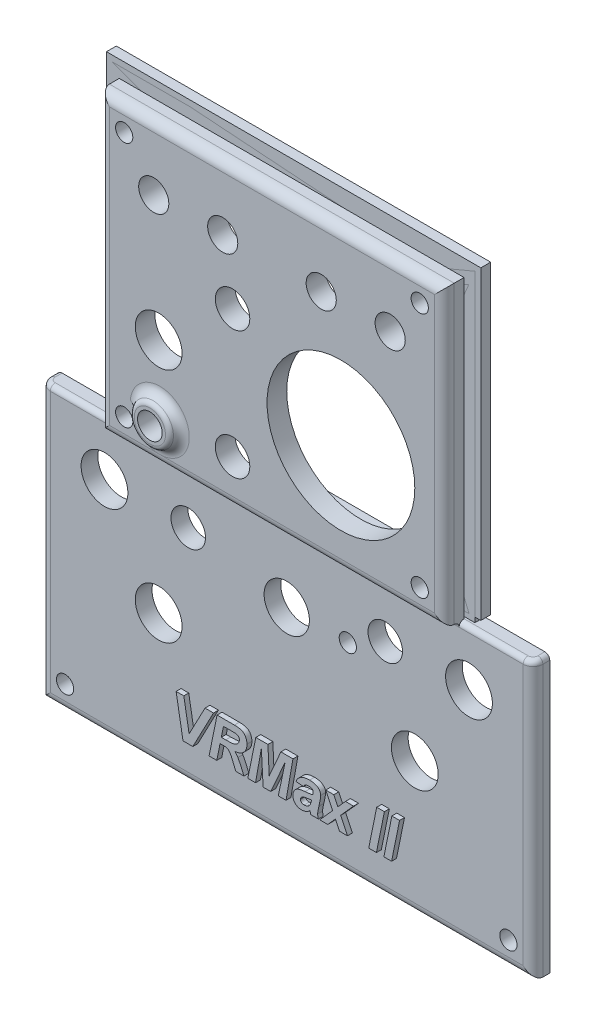
from build123d import *

# Parameters (mm, degrees)
SKETCH1_W                 = 70
SKETCH1_H                 = 60
BOSS_EXTRUDE1_DEPTH       = 4
SKETCH2_W                 = 63.6
SKETCH2_H                 = 53.6
SKETCH2_W_2               = 57.6
SKETCH2_H_2               = 47.6
BOSS_EXTRUDE2_DEPTH       = 2.4
CHAMFER1_SIZE             = 0.5
CHAMFER1_SIZE2            = 1.37373871
FILLET1_R                 = 2
SKETCH3_R                 = 3.060318858
CUT_EXTRUDE1_DEPTH        = 47.539875376
SKETCH4_R                 = 15
CUT_EXTRUDE2_DEPTH        = 47.539875376
SKETCH5_R                 = 3.5
CUT_EXTRUDE3_DEPTH        = 47.539875376
SKETCH6_R                 = 5
SKETCH6_R_2               = 3.060318858
BOSS_EXTRUDE3_DEPTH       = 2
FILLET2_R                 = 1
CUT_EXTRUDE4_REACH        = 48.54
SKETCH7_W                 = 20
SKETCH7_H                 = 60
SKETCH8_R                 = 4.75
CUT_EXTRUDE5_DEPTH        = 47.270941205
CUT_EXTRUDE6_DEPTH        = 47.270941205
CUT_EXTRUDE6_DEPTH_BACK   = 47.270941205
SKETCH9_R                 = 1.75
SKETCH10_R                = 2
CUT_EXTRUDE7_DEPTH        = 2
SKETCH11_R                = 4.75
SKETCH11_R_2              = 3.060318858
BOSS_EXTRUDE4_DEPTH       = 2.4
SKETCH12_R                = 5
CUT_EXTRUDE9_DEPTH        = 47.270941205
SKETCH13_R                = 2.5
CUT_EXTRUDE10_DEPTH       = 47.270941205
SKETCH14_W                = 9
SKETCH14_H                = 9
SKETCH14_W_2              = 6.5
SKETCH14_H_2              = 6.5
BOSS_EXTRUDE5_DEPTH       = 2.4
SKETCH17_R                = 4
SKETCH17_R_2              = 2.5
BOSS_EXTRUDE7_DEPTH       = 2
FILLET5_R                 = 2
FILLET6_R                 = 1
SKETCH18_R                = 3.75
CUT_EXTRUDE13_DEPTH       = 47.539875376
BOSS_EXTRUDE8_START       = 0.4
SKETCH19_W                = 73.6
SKETCH19_H                = 63.6
SKETCH19_W_2              = 65.6
SKETCH19_H_2              = 55.6
BOSS_EXTRUDE8_DEPTH       = 2
SKETCH21_R                = 9.090654542
CUT_EXTRUDE15_DEPTH       = 50.004897727
SKETCH20_W                = 4.957633968
SKETCH20_H                = 6.255912851
SUPPORT_DEPTH             = 2
BOSS_EXTRUDE11_DEPTH      = 2.4
BOSS_EXTRUDE11_DEPTH_BACK = 1
FILLET7_R                 = 2
FILLET8_R                 = 1
FILLET9_R                 = 1
SKETCH24_R                = 4.6
SKETCH24_R_2              = 4.75
SKETCH24_R_3              = 3.5
CUT_EXTRUDE16_DEPTH       = 100.604216783
SKETCH25_R                = 1.75
CUT_EXTRUDE17_DEPTH       = 100.832659995
SKETCH26_R                = 1.75
CUT_EXTRUDE18_DEPTH       = 100.832659995
SKETCH27_R                = 1.75
CUT_EXTRUDE19_DEPTH       = 2
BOSS_EXTRUDE12_DEPTH      = 1
SUPPORT_STRUCT_START      = 0.4
SUPPORT_STRUCT_DEPTH      = 2


# Some blends are built 0.0001 mm under size
with BuildPart() as part:
    # Sketch1 → Boss-Extrude1 (new body)
    with BuildSketch(Plane.XY):
        Rectangle(SKETCH1_W, SKETCH1_H)
    extrude(amount=BOSS_EXTRUDE1_DEPTH)

    # Sketch2 → Boss-Extrude2 (add)
    with BuildSketch(Plane(origin=(0, 0, 0), x_dir=(-1, 0, 0), z_dir=(0, 0, -1))):
        Rectangle(SKETCH2_W, SKETCH2_H)
        Rectangle(SKETCH2_W_2, SKETCH2_H_2, mode=Mode.SUBTRACT)
    extrude(amount=BOSS_EXTRUDE2_DEPTH)

    # Chamfer1
    chamfer1_edges = [part.edges().sort_by_distance(p)[0] for p in [
        (-31.8, 0, -2.4),
        (0, 26.8, -2.4),
        (31.8, 0, -2.4),
        (0, -26.8, -2.4),
    ]]
    chamfer1_side = [part.faces().sort_by_distance(p)[0] for p in [
        (0, 25.968259656, -2.4),
    ]]
    chamfer(chamfer1_edges, length=CHAMFER1_SIZE, length2=CHAMFER1_SIZE2, reference=chamfer1_side[0])

    # Fillet1
    fillet1_edges = [part.edges().sort_by_distance(p)[0] for p in [
        (35, 0, 4),
        (0, 30, 4),
        (-35, 0, 4),
        (0, -30, 4),
    ]]
    fillet(fillet1_edges, radius=FILLET1_R)

    # Sketch3 → Cut-Extrude1 (cut, through all)
    with BuildSketch(Plane.XY.offset(4)):
        with Locations((-24, 17)):
            Circle(SKETCH3_R)
        with Locations((10, 17)):
            Circle(SKETCH3_R)
        with Locations((-10, 17)):
            Circle(SKETCH3_R)
        with Locations((24, 17)):
            Circle(SKETCH3_R)
    extrude(amount=-CUT_EXTRUDE1_DEPTH, mode=Mode.SUBTRACT)

    # Sketch4 → Cut-Extrude2 (cut, through all)
    with BuildSketch(Plane.XY.offset(4)):
        with Locations((14, -8)):
            Circle(SKETCH4_R)
    extrude(amount=-CUT_EXTRUDE2_DEPTH, mode=Mode.SUBTRACT)

    # Sketch5 → Cut-Extrude3 (cut, through all)
    with BuildSketch(Plane.XY.offset(4)):
        with Locations((-8, 5)):
            Circle(SKETCH5_R)
        with Locations((-8, -21)):
            Circle(SKETCH5_R)
    extrude(amount=-CUT_EXTRUDE3_DEPTH, mode=Mode.SUBTRACT)

    # Sketch6 → Boss-Extrude3 (add)
    # profile 1 of 2: a face of its own
    with BuildSketch(Plane(origin=(0, 0, 0), x_dir=(-1, 0, 0), z_dir=(0, 0, -1))):
        with Locations((24, 17)):
            Circle(SKETCH6_R)
        with Locations(Location((24, 17, 0), (0, 0, 180))):
            Circle(SKETCH6_R_2, mode=Mode.SUBTRACT)
    # profile 2 of 2: a face of its own
    with BuildSketch(Plane(origin=(0, 0, 0), x_dir=(-1, 0, 0), z_dir=(0, 0, -1))):
        with Locations((-24, 17)):
            Circle(SKETCH6_R)
        with Locations(Location((-24, 17, 0), (0, 0, 180))):
            Circle(SKETCH6_R_2, mode=Mode.SUBTRACT)
    extrude(amount=BOSS_EXTRUDE3_DEPTH)

    # Fillet2
    fillet2_edges = [part.edges().sort_by_distance(p)[0] for p in [
        (28.8, 18.4, -1),
        (28.8, 15.6, -1),
        (28.8, 23.8, -1.2),
    ]]
    fillet(fillet2_edges, radius=FILLET2_R)

    # Cut-Extrude4: up to this face of the body (flat: up to its plane)
    cut_extrude4_end = Plane(part.part.faces().sort_by_distance((-5.37613494, 1.437428998, 0))[0])
    # Sketch7 → Cut-Extrude4 (cut, up to the picked face)
    with BuildSketch(Plane(origin=(0, 0, -2.4), x_dir=(-1, 0, 0), z_dir=(0, 0, -1)), mode=Mode.PRIVATE) as cut_extrude4_sk1:
        with Locations((25, -2.259161332)):
            Rectangle(SKETCH7_W, SKETCH7_H)
    cut_extrude4_tool1 = split(extrude(cut_extrude4_sk1.sketch, amount=-CUT_EXTRUDE4_REACH, mode=Mode.PRIVATE), bisect_by=cut_extrude4_end, keep=Keep.BOTH, mode=Mode.PRIVATE)
    add(cut_extrude4_tool1.solids().sort_by(Axis((-25, -2.259161, -2.4), (0, 0, 1)))[0], mode=Mode.SUBTRACT)

    # Sketch8 → Cut-Extrude5 (cut, through all)
    with BuildSketch(Plane(origin=(0, 0, 0), x_dir=(-1, 0, 0), z_dir=(0, 0, -1))):
        with Locations((23, -8)):
            Circle(SKETCH8_R)
    extrude(amount=-CUT_EXTRUDE5_DEPTH, mode=Mode.SUBTRACT)

    # Sketch9 → Cut-Extrude6 (cut, two sides: drawn at the far end of the back side and taken through both)
    with BuildSketch(Plane(origin=(0, 0, 0), x_dir=(-1, 0, 0), z_dir=(0, 0, -1)).offset(-CUT_EXTRUDE6_DEPTH_BACK)):
        with Locations((30, 25)):
            Circle(SKETCH9_R)
        with Locations((30, -25)):
            Circle(SKETCH9_R)
        with Locations((-30, -25)):
            Circle(SKETCH9_R)
        with Locations((-30, 25)):
            Circle(SKETCH9_R)
    extrude(amount=CUT_EXTRUDE6_DEPTH + CUT_EXTRUDE6_DEPTH_BACK, mode=Mode.SUBTRACT)

    # Sketch10 → Cut-Extrude7 (cut)
    with BuildSketch(Plane(origin=(0, 0, 0), x_dir=(-1, 0, 0), z_dir=(0, 0, -1))):
        with Locations((23, 1)):
            Circle(SKETCH10_R)
    extrude(amount=-CUT_EXTRUDE7_DEPTH, mode=Mode.SUBTRACT)

    # Sketch11 → Boss-Extrude4 (add)
    with BuildSketch(Plane(origin=(0, 0, 0), x_dir=(-1, 0, 0), z_dir=(0, 0, -1))):
        with Locations(Location((24, 17, 0), (0, 0, 180))):
            Circle(SKETCH11_R)
        with Locations(Location((24, 17, 0), (0, 0, 180))):
            Circle(SKETCH11_R_2, mode=Mode.SUBTRACT)
    extrude(amount=BOSS_EXTRUDE4_DEPTH)

    # Sketch12 → Cut-Extrude9 (cut, through all)
    with BuildSketch(Plane(origin=(0, 0, 0), x_dir=(-1, 0, 0), z_dir=(0, 0, -1))):
        with Locations((-30, 25)):
            Circle(SKETCH12_R)
        with Locations((-30, -25)):
            Circle(SKETCH12_R)
    extrude(amount=CUT_EXTRUDE9_DEPTH, mode=Mode.SUBTRACT)

    # Sketch13 → Cut-Extrude10 (cut, through all)
    with BuildSketch(Plane(origin=(0, 0, 0), x_dir=(-1, 0, 0), z_dir=(0, 0, -1))):
        with Locations((22.783208656, -22)):
            Circle(SKETCH13_R)
    extrude(amount=-CUT_EXTRUDE10_DEPTH, mode=Mode.SUBTRACT)

    # Sketch14 → Boss-Extrude5 (add)
    with BuildSketch(Plane(origin=(0, 0, 0), x_dir=(-1, 0, 0), z_dir=(0, 0, -1))):
        with Locations((22.783208656, -22)):
            Rectangle(SKETCH14_W, SKETCH14_H)
        with Locations((22.783208656, -22)):
            Rectangle(SKETCH14_W_2, SKETCH14_H_2, mode=Mode.SUBTRACT)
    extrude(amount=BOSS_EXTRUDE5_DEPTH)

    # Sketch17 → Boss-Extrude7 (add)
    with BuildSketch(Plane.XY.offset(4)):
        with Locations((-22.783208656, -22)):
            Circle(SKETCH17_R)
        with Locations(Location((-22.783208656, -22, 0), (0, 0, 180))):
            Circle(SKETCH17_R_2, mode=Mode.SUBTRACT)
    extrude(amount=BOSS_EXTRUDE7_DEPTH)

    # Fillet5
    fillet5_edges = [part.edges().sort_by_distance(p)[0] for p in [
        (-26.783208656, -22, 4),
    ]]
    fillet(fillet5_edges, radius=FILLET5_R - 0.0001)  # a hair under: the kernel refuses the full size

    # Fillet6
    fillet6_edges = [part.edges().sort_by_distance(p)[0] for p in [
        (-26.783208656, -22, 6),
    ]]
    fillet(fillet6_edges, radius=FILLET6_R)

    # Sketch18 → Cut-Extrude13 (cut, through all)
    with BuildSketch(Plane.XY.offset(4)):
        with Locations((-30, -25)):
            Circle(SKETCH18_R)
    extrude(amount=CUT_EXTRUDE13_DEPTH, mode=Mode.SUBTRACT)

    # Sketch21 → Cut-Extrude15 (cut, through all)
    with BuildSketch(Plane(origin=(0, 0, 0), x_dir=(-1, 0, 0), z_dir=(0, 0, -1))):
        with Locations((8, -21)):
            Circle(SKETCH21_R)
    extrude(amount=CUT_EXTRUDE15_DEPTH, mode=Mode.SUBTRACT)

    # Sketch23 → Boss-Extrude11 (add, two sides: drawn at the far end of the back side and taken through both)
    with BuildSketch(Plane(origin=(0, 0, 0), x_dir=(-1, 0, 0), z_dir=(0, 0, -1)).offset(-BOSS_EXTRUDE11_DEPTH_BACK)):
        Polygon((35, -30), (50, -30), (50, -86), (-50, -86), (-50, -30), (-35, -30), align=None)
    extrude(amount=BOSS_EXTRUDE11_DEPTH + BOSS_EXTRUDE11_DEPTH_BACK)

    # Fillet7
    fillet7_edges = [part.edges().sort_by_distance(p)[0] for p in [
        (-50, -58, 1),
        (0, -86, 1),
        (50, -58, 1),
    ]]
    fillet(fillet7_edges, radius=FILLET7_R)

    # Fillet8
    # the kernel refuses this fillet: 1 mm, written as the material it takes off along each edge
    with BuildSketch(Plane(origin=(50, -30, -1), x_dir=(0, -1, 0), z_dir=(0, 0, -1)), Plane(origin=(-50, -30, -4.9), x_dir=(0, -1, 0), z_dir=(0, 0, 1))) as fillet8_piece_1:
        with BuildLine():
            CenterArc((FILLET8_R, FILLET8_R), FILLET8_R, 180, 90)
            Line((0, FILLET8_R), (0, 0))
            Line((0, 0), (FILLET8_R, 0))
        make_face()
    extrude(amount=3.9, mode=Mode.SUBTRACT)
    with BuildSketch(Plane(origin=(48, -30, -1), x_dir=(0, 0, 1), z_dir=(-1, 0, 0))) as fillet8_piece_2:
        with BuildLine():
            CenterArc((2 - FILLET8_R, -FILLET8_R), FILLET8_R, 0, 90)
            Line((2 - FILLET8_R, 0), (2, 0))
            Line((2, 0), (2, -FILLET8_R))
        make_face()
    revolve(axis=Axis((48, -30, -1), (0, 1, 0)), revolution_arc=90, mode=Mode.SUBTRACT)
    with BuildSketch(Plane(origin=(35, -30, 1), x_dir=(0, -1, 0), z_dir=(1, 0, 0)), Plane(origin=(-48, -30, 1), x_dir=(0, -1, 0), z_dir=(1, 0, 0))) as fillet8_piece_3:
        with BuildLine():
            CenterArc((FILLET8_R, FILLET8_R), FILLET8_R, 180, 90)
            Line((0, FILLET8_R), (0, 0))
            Line((0, 0), (FILLET8_R, 0))
        make_face()
    extrude(amount=13, mode=Mode.SUBTRACT)
    with BuildSketch(Plane(origin=(-48, -30, -1), x_dir=(0, 0, 1), z_dir=(1, 0, 0))) as fillet8_piece_4:
        with BuildLine():
            CenterArc((2 - FILLET8_R, FILLET8_R), FILLET8_R, 270, 90)
            Line((2 - FILLET8_R, 0), (2, 0))
            Line((2, 0), (2, FILLET8_R))
        make_face()
    revolve(axis=Axis((-48, -30, -1), (0, -1, 0)), revolution_arc=90, mode=Mode.SUBTRACT)

    # Fillet9
    fillet9_edges = [part.edges().sort_by_distance(p)[0] for p in [
        (0, -30, 1),
    ]]
    fillet(fillet9_edges, radius=FILLET9_R - 0.0001)  # a hair under: the kernel refuses the full size

    # Sketch24 → Cut-Extrude16 (cut, through all)
    with BuildSketch(Plane.XY.offset(1)):
        with Locations((0, -45)):
            Circle(SKETCH24_R)
        with Locations((-37, -41)):
            Circle(SKETCH24_R_2)
        with Locations((37, -41)):
            Circle(SKETCH24_R_2)
        with Locations((-26, -59)):
            Circle(SKETCH24_R_2)
        with Locations((26, -59)):
            Circle(SKETCH24_R_2)
        with Locations((-20, -41)):
            Circle(SKETCH24_R_3)
        with Locations((20, -41)):
            Circle(SKETCH24_R_3)
    extrude(amount=-CUT_EXTRUDE16_DEPTH, mode=Mode.SUBTRACT)

    # Sketch25 → Cut-Extrude17 (cut, through all)
    with BuildSketch(Plane(origin=(0, 0, -2.4), x_dir=(-1, 0, 0), z_dir=(0, 0, -1))):
        with Locations((45, -81)):
            Circle(SKETCH25_R)
        with Locations((-45, -81)):
            Circle(SKETCH25_R)
    extrude(amount=-CUT_EXTRUDE17_DEPTH, mode=Mode.SUBTRACT)

    # Sketch26 → Cut-Extrude18 (cut, through all)
    with BuildSketch(Plane(origin=(0, 0, -2.4), x_dir=(-1, 0, 0), z_dir=(0, 0, -1))):
        with Locations((-12.4, -45)):
            Circle(SKETCH26_R)
    extrude(amount=-CUT_EXTRUDE18_DEPTH, mode=Mode.SUBTRACT)

    # Sketch27 → Cut-Extrude19 (cut)
    with BuildSketch(Plane(origin=(0, 0, -2.4), x_dir=(-1, 0, 0), z_dir=(0, 0, -1))):
        with Locations((17.3, -59)):
            Circle(SKETCH27_R)
        with Locations((-17.3, -59)):
            Circle(SKETCH27_R)
        with Locations((-28.3, -41)):
            Circle(SKETCH27_R)
        with Locations((28.3, -41)):
            Circle(SKETCH27_R)
    extrude(amount=-CUT_EXTRUDE19_DEPTH, mode=Mode.SUBTRACT)

    # Sketch28 → Boss-Extrude12 (add)
    # profile 1 of 7: a face of its own
    with BuildSketch(Plane.XY.offset(1)):
        Polygon((-18.065705128, -78), (-20.057692308, -78), (-21.456730769, -70), (-19.897435897, -70), (-18.820512821, -76.153846154), (-15.58974359, -70), (-13.866987179, -70), align=None)
    # profile 2 of 7: a face of its own
    with BuildSketch(Plane.XY.offset(1)):
        with BuildLine():
            Line((-13.201923077, -78), (-14.769230769, -78))
            Line((-14.769230769, -78), (-13.142628205, -70))
            Line((-13.142628205, -70), (-9.620192308, -70))
            add(Edge.make_bspline(
                [(-9.620192308, -70), (-9.546475051, -70.000807233), (-9.403269954, -70.002375386), (-9.194671422, -70.008965823), (-8.999329388, -70.026786672), (-8.815573362, -70.043984889), (-8.645219924, -70.071996557), (-8.486735057, -70.103596159), (-8.340952315, -70.1415341), (-8.206825844, -70.187125768), (-8.080888635, -70.237848334), (-7.964227917, -70.301932313), (-7.850893828, -70.37161524), (-7.745347224, -70.453544028), (-7.647122188, -70.546194049), (-7.553486884, -70.647591974), (-7.46610026, -70.759015456), (-7.385748319, -70.879580955), (-7.313716751, -71.008268298), (-7.249474489, -71.143368983), (-7.196864869, -71.286402734), (-7.151276952, -71.434794296), (-7.118305758, -71.590977865), (-7.094191928, -71.753657589), (-7.079641835, -71.922811057), (-7.077836759, -72.037899241), (-7.076923077, -72.096153846)],
                knots=[0, 0, 0, 0, 1.397997146, 2.71578631, 3.955711479, 5.116837282, 6.214271876, 7.22740948, 8.180699214, 9.067986365, 9.91261871, 10.750971626, 11.588467393, 12.433342657, 13.279006929, 14.146412957, 15.048152737, 15.961200041, 16.890950814, 17.84251689, 18.794514173, 19.778313476, 20.783622796, 21.817908339, 22.895482704, 24, 24, 24, 24], degree=3))
            add(Edge.make_bspline(
                [(-7.076923077, -72.096153846), (-7.078809064, -72.179563216), (-7.082494755, -72.342566023), (-7.110224834, -72.581717618), (-7.155985187, -72.809315221), (-7.222291198, -73.026070649), (-7.307511401, -73.231366647), (-7.410122148, -73.426744003), (-7.532868629, -73.60975828), (-7.67267657, -73.782075802), (-7.830964936, -73.942168487), (-8.012646875, -74.082294502), (-8.210686783, -74.210545035), (-8.430103901, -74.321011767), (-8.669860126, -74.414600492), (-8.928180352, -74.495359601), (-9.206643236, -74.557225265), (-9.399371554, -74.586116772), (-9.498397436, -74.600961538)],
                knots=[0, 0, 0, 0, 1.034210287, 2.021106028, 2.981224027, 3.909550721, 4.827322501, 5.734126229, 6.641776499, 7.55535462, 8.482853643, 9.42644268, 10.394866648, 11.405142831, 12.466783848, 13.583603239, 14.758429358, 16, 16, 16, 16], degree=3))
            add(Edge.make_bspline(
                [(-9.498397436, -74.600961538), (-9.445459712, -74.650650633), (-9.336358501, -74.753056629), (-9.18970531, -74.932326156), (-9.041486416, -75.128669962), (-8.953867379, -75.273183794), (-8.908653846, -75.34775641)],
                knots=[0, 0, 0, 0, 0.911289116, 1.878107672, 2.905052469, 4, 4, 4, 4], degree=3))
            add(Edge.make_bspline(
                [(-8.908653846, -75.34775641), (-8.862269714, -75.429779293), (-8.76565771, -75.600622098), (-8.623961685, -75.872042647), (-8.475404655, -76.166475379), (-8.328293277, -76.487420171), (-8.173380034, -76.830985687), (-8.015668279, -77.198734057), (-7.852907952, -77.590508542), (-7.746854124, -77.860919916), (-7.692307692, -78)],
                knots=[0, 0, 0, 0, 0.774320282, 1.612806617, 2.515893427, 3.484157077, 4.513797032, 5.613040525, 6.772320409, 8, 8, 8, 8], degree=3))
            Line((-7.692307692, -78), (-9.333333333, -78))
            add(Edge.make_bspline(
                [(-9.333333333, -78), (-9.353769455, -77.940026866), (-9.397439662, -77.811869521), (-9.47613188, -77.609683987), (-9.565065419, -77.382866314), (-9.667618444, -77.132596804), (-9.785455556, -76.860197696), (-9.915257887, -76.563718193), (-10.057625339, -76.242836599), (-10.158945085, -76.021791878), (-10.211538462, -75.907051282)],
                knots=[0, 0, 0, 0, 0.669633086, 1.430947364, 2.292823778, 3.244897855, 4.289531818, 5.429840925, 6.665873656, 8, 8, 8, 8], degree=3))
            add(Edge.make_bspline(
                [(-10.211538462, -75.907051282), (-10.240847342, -75.84531254), (-10.297532044, -75.725907017), (-10.389442359, -75.558016867), (-10.480457076, -75.404120555), (-10.574452871, -75.267330929), (-10.669499712, -75.145065489), (-10.767066999, -75.040108677), (-10.864387343, -74.948262601), (-10.934244083, -74.898843728), (-10.967948718, -74.875)],
                knots=[0, 0, 0, 0, 1.266796771, 2.450042299, 3.547265759, 4.580161745, 5.525235817, 6.415311767, 7.235416088, 8, 8, 8, 8], degree=3))
            add(Edge.make_bspline(
                [(-10.967948718, -74.875), (-10.990114573, -74.862177181), (-11.036778902, -74.835182137), (-11.116685726, -74.803601227), (-11.207484416, -74.777237214), (-11.309552097, -74.753945797), (-11.423412246, -74.739719303), (-11.548831444, -74.725586133), (-11.685866367, -74.720657781), (-11.78098554, -74.718871558), (-11.830128205, -74.717948718)],
                knots=[0, 0, 0, 0, 0.692669078, 1.458231005, 2.318635533, 3.252171975, 4.289336311, 5.423539077, 6.668889229, 8, 8, 8, 8], degree=3))
            Line((-11.830128205, -74.717948718), (-12.53525641, -74.717948718))
            Line((-12.53525641, -74.717948718), (-13.201923077, -78))
        make_face()
        with BuildLine():
            Line((-12.28525641, -73.487179487), (-11.384615385, -73.487179487))
            add(Edge.make_bspline(
                [(-11.384615385, -73.487179487), (-11.275641013, -73.486282879), (-11.066755418, -73.484564232), (-10.76802905, -73.479398723), (-10.497682622, -73.466177121), (-10.256613854, -73.449286062), (-10.043850668, -73.427019391), (-9.860258495, -73.400741205), (-9.704888203, -73.369215037), (-9.538099717, -73.321675273), (-9.360456982, -73.242071336), (-9.168237513, -73.132205616), (-9.005135712, -72.992389469), (-8.865324695, -72.836747188), (-8.755759164, -72.665421008), (-8.673623681, -72.488592642), (-8.625078116, -72.305442433), (-8.618613362, -72.181896095), (-8.615384615, -72.120192308)],
                knots=[0, 0, 0, 0, 1.50888834, 2.892285894, 4.136248101, 5.256027101, 6.237795427, 7.097596577, 7.822872553, 8.431428343, 9.494855671, 10.509612591, 11.485961217, 12.455196353, 13.396863832, 14.290544765, 15.146232392, 16, 16, 16, 16], degree=3))
            add(Edge.make_bspline(
                [(-8.615384615, -72.120192308), (-8.616877719, -72.084898132), (-8.619788961, -72.016081841), (-8.634794411, -71.915989445), (-8.665036348, -71.823254669), (-8.704101638, -71.735989105), (-8.758010489, -71.657523207), (-8.822041574, -71.585427337), (-8.896902111, -71.5193774), (-8.954568153, -71.483194625), (-8.983974359, -71.46474359)],
                knots=[0, 0, 0, 0, 1.072207581, 2.090581457, 3.059874968, 4.024818191, 4.982787312, 5.936216595, 6.947594817, 8, 8, 8, 8], degree=3))
            add(Edge.make_bspline(
                [(-8.983974359, -71.46474359), (-9.00511528, -71.454064348), (-9.051920774, -71.430420761), (-9.134064273, -71.404444969), (-9.232338505, -71.382924417), (-9.346602997, -71.362714547), (-9.478044011, -71.352249107), (-9.625334506, -71.339766908), (-9.789484327, -71.333879104), (-9.90437833, -71.333521315), (-9.96474359, -71.333333333)],
                knots=[0, 0, 0, 0, 0.56921737, 1.260233634, 2.064715267, 2.990294769, 4.049329649, 5.235318658, 6.547437606, 8, 8, 8, 8], degree=3))
            Line((-9.96474359, -71.333333333), (-11.846153846, -71.333333333))
            Line((-11.846153846, -71.333333333), (-12.28525641, -73.487179487))
        make_face(mode=Mode.SUBTRACT)
    # profile 3 of 7: a face of its own
    with BuildSketch(Plane.XY.offset(1)):
        Polygon((-2.256410256, -78), (-3.794871795, -78), (-4.153846154, -71.375), (-5.333333333, -78), (-6.895833333, -78), (-5.278846154, -70), (-2.820512821, -70), (-2.564102564, -75.41025641), (-0.1875, -70), (2.267628205, -70), (0.849358974, -78), (-0.717948718, -78), (0.666666667, -71.435897436), align=None)
    # profile 4 of 7: a face of its own
    with BuildSketch(Plane.XY.offset(1)):
        with BuildLine():
            Line((4.41025641, -73.794871795), (2.871794872, -73.673076923))
            add(Edge.make_bspline(
                [(2.871794872, -73.673076923), (2.895129324, -73.610572233), (2.941293781, -73.486914093), (3.031557458, -73.312447668), (3.129959547, -73.146344871), (3.243354779, -72.991921949), (3.368142554, -72.847105526), (3.507186691, -72.71380826), (3.657827981, -72.589886158), (3.822171591, -72.477809838), (3.998632377, -72.375691988), (4.190735828, -72.289608466), (4.396083283, -72.216247942), (4.614437916, -72.155028539), (4.846540408, -72.109085989), (5.092182777, -72.075896765), (5.35164501, -72.054320171), (5.52933611, -72.052309922), (5.620192308, -72.051282051)],
                knots=[0, 0, 0, 0, 0.933732093, 1.84727857, 2.746836404, 3.635844904, 4.52699211, 5.421306484, 6.33052195, 7.25618423, 8.204699909, 9.182513069, 10.200250981, 11.256855991, 12.355977279, 13.511542015, 14.727613078, 16, 16, 16, 16], degree=3))
            add(Edge.make_bspline(
                [(5.620192308, -72.051282051), (5.714264888, -72.052100063), (5.895759699, -72.053678258), (6.158424616, -72.07735493), (6.401965234, -72.111960642), (6.627632163, -72.158669565), (6.83396949, -72.223297121), (7.021495078, -72.301100722), (7.190700782, -72.392874989), (7.339465751, -72.499330699), (7.471151944, -72.614157382), (7.584147665, -72.737384735), (7.681303798, -72.865594419), (7.760398193, -73.001145694), (7.822087355, -73.143142186), (7.864687119, -73.291907354), (7.893901674, -73.446506796), (7.896247411, -73.552212588), (7.897435897, -73.605769231)],
                knots=[0, 0, 0, 0, 1.460168788, 2.817112657, 4.09097887, 5.278537855, 6.390836495, 7.442934704, 8.426601762, 9.372476088, 10.277578396, 11.13458179, 11.964008963, 12.770602901, 13.565642486, 14.360898367, 15.16953669, 16, 16, 16, 16], degree=3))
            add(Edge.make_bspline(
                [(7.897435897, -73.605769231), (7.895272324, -73.696145234), (7.890787608, -73.883479198), (7.862038296, -74.099214079), (7.831265309, -74.263897515), (7.80962865, -74.383288039), (7.778286353, -74.532048109), (7.741635704, -74.711153743), (7.696866108, -74.920050887), (7.643774596, -75.159325431), (7.582470855, -75.428344818), (7.539997748, -75.618040603), (7.517628205, -75.717948718)],
                knots=[0, 0, 0, 0, 1.260810853, 2.613444794, 3.030137618, 3.598846236, 4.306390159, 5.151362656, 6.149896389, 7.287460165, 8.571371831, 10, 10, 10, 10], degree=3))
            add(Edge.make_bspline(
                [(7.517628205, -75.717948718), (7.499279379, -75.801242749), (7.464026346, -75.961273001), (7.416282008, -76.192115481), (7.373492254, -76.402741229), (7.341825914, -76.594826714), (7.316196202, -76.766868132), (7.296311045, -76.91954557), (7.284053495, -77.052679224), (7.282682358, -77.135128886), (7.282051282, -77.173076923)],
                knots=[0, 0, 0, 0, 1.386534385, 2.663905748, 3.832242334, 4.880153071, 5.828280732, 6.659833236, 7.383178825, 8, 8, 8, 8], degree=3))
            add(Edge.make_bspline(
                [(7.282051282, -77.173076923), (7.283539351, -77.237264149), (7.286588784, -77.368800137), (7.314438975, -77.571210444), (7.357107402, -77.783243467), (7.39753555, -77.92652017), (7.418269231, -78)],
                knots=[0, 0, 0, 0, 0.91558309, 1.876263148, 2.91083602, 4, 4, 4, 4], degree=3))
            Line((7.418269231, -78), (5.846153846, -78))
            add(Edge.make_bspline(
                [(5.846153846, -78), (5.821018431, -77.89412447), (5.770279512, -77.680401723), (5.752540882, -77.461448247), (5.743589744, -77.350961538)],
                knots=[0, 0, 0, 0, 0.99077456, 2, 2, 2, 2], degree=3))
            add(Edge.make_bspline(
                [(5.743589744, -77.350961538), (5.682979495, -77.41177186), (5.563398897, -77.53174719), (5.361419011, -77.684307526), (5.148144292, -77.81512586), (4.922321022, -77.919919479), (4.690348858, -78.001805413), (4.455135204, -78.059118573), (4.219144223, -78.096437037), (4.061033926, -78.100528527), (3.982371795, -78.102564103)],
                knots=[0, 0, 0, 0, 1.045899096, 2.063499836, 3.077947096, 4.092122405, 5.093432747, 6.073019921, 7.041299891, 8, 8, 8, 8], degree=3))
            add(Edge.make_bspline(
                [(3.982371795, -78.102564103), (3.921426199, -78.10078186), (3.801851442, -78.097285116), (3.626209216, -78.07697927), (3.458928977, -78.039692696), (3.299452314, -77.988450015), (3.148043454, -77.922443811), (3.004643079, -77.841957147), (2.869579247, -77.746692426), (2.742969289, -77.638694542), (2.630686163, -77.516982131), (2.529662723, -77.388047064), (2.444154302, -77.249661686), (2.375529085, -77.10204196), (2.322497501, -76.946653653), (2.283506729, -76.783662469), (2.261277305, -76.611725662), (2.258053119, -76.494186286), (2.256410256, -76.434294872)],
                knots=[0, 0, 0, 0, 1.087341335, 2.133354745, 3.148307855, 4.139727867, 5.116941834, 6.089685533, 7.067828234, 8.06107828, 9.05213188, 10.016579207, 10.979188905, 11.94687887, 12.914193434, 13.903412937, 14.931697876, 16, 16, 16, 16], degree=3))
            add(Edge.make_bspline(
                [(2.256410256, -76.434294872), (2.257693291, -76.36742223), (2.260197616, -76.236895041), (2.287213715, -76.046572442), (2.32779571, -75.865750454), (2.388138277, -75.696160542), (2.460880755, -75.535035105), (2.555641596, -75.38731463), (2.665195225, -75.248871762), (2.791153424, -75.118340542), (2.940408509, -75.000111503), (3.115753857, -74.896566416), (3.316099761, -74.802662488), (3.54399429, -74.724808571), (3.796921165, -74.655149401), (4.076082357, -74.600259506), (4.381612139, -74.557090118), (4.594441117, -74.538509483), (4.705128205, -74.528846154)],
                knots=[0, 0, 0, 0, 0.917409775, 1.790671262, 2.633854413, 3.457191384, 4.257743596, 5.055300814, 5.859305215, 6.6786809, 7.539943444, 8.464331817, 9.468233045, 10.572246771, 11.765994999, 13.067567494, 14.474914376, 16, 16, 16, 16], degree=3))
            add(Edge.make_bspline(
                [(4.705128205, -74.528846154), (4.798088504, -74.520970685), (4.975527253, -74.505938319), (5.229904469, -74.482218683), (5.460187778, -74.456714911), (5.666540006, -74.430151686), (5.848566144, -74.400640986), (6.006506067, -74.372891724), (6.140975981, -74.343081646), (6.221269196, -74.318802763), (6.258012821, -74.307692308)],
                knots=[0, 0, 0, 0, 1.425106299, 2.720183577, 3.902454828, 4.9641961, 5.897901358, 6.718985636, 7.413784699, 8, 8, 8, 8], degree=3))
            add(Edge.make_bspline(
                [(6.258012821, -74.307692308), (6.273806483, -74.255552676), (6.303550762, -74.157357862), (6.332965346, -74.015626278), (6.354474599, -73.8911331), (6.357557461, -73.813105466), (6.358974359, -73.77724359)],
                knots=[0, 0, 0, 0, 1.206220989, 2.271681653, 3.205656569, 4, 4, 4, 4], degree=3))
            add(Edge.make_bspline(
                [(6.358974359, -73.77724359), (6.356027341, -73.736336604), (6.350218049, -73.655698936), (6.308814077, -73.53970875), (6.236494275, -73.436867827), (6.139315281, -73.344626434), (6.01420664, -73.268634289), (5.8611898, -73.216882371), (5.683456835, -73.185249256), (5.55623781, -73.181483767), (5.488782051, -73.179487179)],
                knots=[0, 0, 0, 0, 0.830971987, 1.638048878, 2.466249647, 3.364841247, 4.344348405, 5.415827387, 6.629785712, 8, 8, 8, 8], degree=3))
            add(Edge.make_bspline(
                [(5.488782051, -73.179487179), (5.416533529, -73.180943667), (5.279328213, -73.183709646), (5.085644487, -73.214646162), (4.914803275, -73.262785837), (4.768474706, -73.33374714), (4.645320155, -73.424053317), (4.543235507, -73.530401622), (4.462040983, -73.654871285), (4.427748763, -73.74758091), (4.41025641, -73.794871795)],
                knots=[0, 0, 0, 0, 1.294509745, 2.458370264, 3.507140087, 4.4668133, 5.35775872, 6.231806486, 7.098050097, 8, 8, 8, 8], degree=3))
        make_face()
        with BuildLine():
            add(Edge.make_bspline(
                [(6.046474359, -75.333333333), (5.989455362, -75.346375966), (5.860227403, -75.375935814), (5.7288556, -75.393841153), (5.655448718, -75.403846154)],
                knots=[0, 0, 0, 0, 0.882456049, 2, 2, 2, 2], degree=3))
            add(Edge.make_bspline(
                [(5.655448718, -75.403846154), (5.558141844, -75.415505057), (5.371709375, -75.437842618), (5.106193103, -75.479705242), (4.866711711, -75.524361954), (4.653573481, -75.571470654), (4.466928643, -75.623435555), (4.307779341, -75.681655203), (4.172433106, -75.740262728), (4.096169657, -75.789655568), (4.060897436, -75.8125)],
                knots=[0, 0, 0, 0, 1.417677444, 2.716160717, 3.887783452, 4.941426608, 5.87344053, 6.687522862, 7.392972846, 8, 8, 8, 8], degree=3))
            add(Edge.make_bspline(
                [(4.060897436, -75.8125), (4.019791767, -75.84579172), (3.940456815, -75.910045558), (3.857764132, -76.037903071), (3.80203927, -76.179284116), (3.797308885, -76.280953418), (3.794871795, -76.333333333)],
                knots=[0, 0, 0, 0, 1.038069845, 2.003500358, 2.971405526, 4, 4, 4, 4], degree=3))
            add(Edge.make_bspline(
                [(3.794871795, -76.333333333), (3.797119517, -76.376945053), (3.80151556, -76.462239846), (3.842769857, -76.583671303), (3.905778595, -76.695733437), (3.997073403, -76.792389433), (4.106751418, -76.875033878), (4.236712191, -76.932578342), (4.381545203, -76.969140903), (4.483737404, -76.972574251), (4.536858974, -76.974358974)],
                knots=[0, 0, 0, 0, 0.952075654, 1.862047548, 2.778984473, 3.74758699, 4.751223439, 5.766718408, 6.839095128, 8, 8, 8, 8], degree=3))
            add(Edge.make_bspline(
                [(4.536858974, -76.974358974), (4.597362217, -76.972111622), (4.717613482, -76.967644971), (4.894715499, -76.934570655), (5.066224236, -76.881173774), (5.229871014, -76.808171517), (5.380361665, -76.718020395), (5.513794183, -76.614634913), (5.627103311, -76.499447186), (5.720959564, -76.365999737), (5.800570306, -76.207959436), (5.872643943, -76.017291874), (5.943717795, -75.791270479), (5.981468696, -75.626395236), (6.001602564, -75.538461538)],
                knots=[0, 0, 0, 0, 0.962890362, 1.913761604, 2.857953286, 3.817344201, 4.759580357, 5.644248394, 6.498298055, 7.321864539, 8.230969057, 9.308100957, 10.564316672, 12, 12, 12, 12], degree=3))
            Line((6.001602564, -75.538461538), (6.046474359, -75.333333333))
        make_face(mode=Mode.SUBTRACT)
    # profile 5 of 7: a face of its own
    with BuildSketch(Plane.XY.offset(1)):
        Polygon((10.876602564, -76.275641026), (9.333333333, -78), (7.692307692, -78), (10.307692308, -75.078525641), (8.923076923, -72.153846154), (10.564102564, -72.153846154), (11.379807692, -73.879807692), (12.923076923, -72.153846154), (14.564102564, -72.153846154), (11.948717949, -75.075320513), (13.333333333, -78), (11.692307692, -78), align=None)
    # profile 6 of 7: a face of its own
    with BuildSketch(Plane.XY.offset(1)):
        Polygon((17.641025641, -78), (19.267628205, -70), (20.833333333, -70), (19.206730769, -78), align=None)
    # profile 7 of 7: a face of its own
    with BuildSketch(Plane.XY.offset(1)):
        Polygon((20.717948718, -78), (22.344551282, -70), (23.91025641, -70), (22.283653846, -78), align=None)
    extrude(amount=BOSS_EXTRUDE12_DEPTH)


with BuildPart() as body_2:
    # Sketch19 → Boss-Extrude8 (new body)
    with BuildSketch(Plane(origin=(0, 0, 0), x_dir=(-1, 0, 0), z_dir=(0, 0, -1)).offset(BOSS_EXTRUDE8_START)):
        Rectangle(SKETCH19_W, SKETCH19_H)
        Rectangle(SKETCH19_W_2, SKETCH19_H_2, mode=Mode.SUBTRACT)
    extrude(amount=BOSS_EXTRUDE8_DEPTH)

    # Sketch20 → support (add)
    with BuildSketch(Plane(origin=(0, 0, -2.4), x_dir=(-1, 0, 0), z_dir=(0, 0, -1))):
        with BuildLine():
            Line((-27.256195726, 27.8), (-32.8, 27.8))
            Line((-32.8, 27.8), (-32.8, 22.256195726))
            ThreePointArc((-32.8, 22.256195726), (-27.716473501, 22.716473501), (-27.256195726, 27.8))
        make_face()
        with BuildLine():
            Line((-32.8, -22.256195726), (-32.8, -27.8))
            Line((-32.8, -27.8), (-27.256195726, -27.8))
            ThreePointArc((-27.256195726, -27.8), (-27.716473501, -22.716473501), (-32.8, -22.256195726))
        make_face()
        with BuildLine():
            Line((25.880176368, 27.8), (32.8, 27.8))
            Line((32.8, 27.8), (32.8, 20.558285253))
            ThreePointArc((32.8, 20.558285253), (28.167025653, 23.058222222), (25.880176368, 27.8))
        make_face()
        with Locations((30.321183016, -24.672043575)):
            Rectangle(SKETCH20_W, SKETCH20_H)
    extrude(amount=-SUPPORT_DEPTH)


with BuildPart() as body_3:
    # Sketch29 → support_struct (new body)
    with BuildSketch(Plane(origin=(0, 0, 0), x_dir=(-1, 0, 0), z_dir=(0, 0, -1)).offset(SUPPORT_STRUCT_START)):
        Polygon((-38, -29), (-33, -29), (-33, 28), (33, 28), (33, -29), (38, -29), (38, 33), (-38, 33), align=None)
    extrude(amount=SUPPORT_STRUCT_DEPTH)


solid = Compound([part.part, body_2.part, body_3.part])
